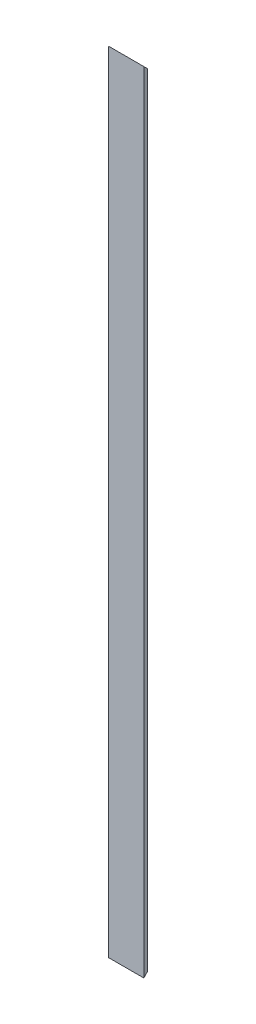
from build123d import *

# Parameters (mm, degrees)
EXTRUDE_1_DEPTH     = 1000
CUT_EXTRUDE_1_DEPTH = 1003.022953829


with BuildPart() as part:
    # Эскиз1 → Вытянуть-Тонкостенный1 (new body)
    with BuildSketch(Plane(origin=(0, 0, 0), x_dir=(1, 0, 0), z_dir=(0, 1, 0))):
        Polygon((0, 45), (0, 0), (45, 0), (45, 5), (5, 5), (5, 45), align=None)
    extrude(amount=EXTRUDE_1_DEPTH)

    # Эскиз2 → Вырез-Вытянуть1 (cut, through all)
    with BuildSketch(Plane.ZY):
        Polygon((0, 0), (-45, 45), (-45, 0), align=None)
        Polygon((-45, 1000), (0, 1000), (-45, 955), align=None)
    extrude(amount=-CUT_EXTRUDE_1_DEPTH, mode=Mode.SUBTRACT)


solid = part.part
